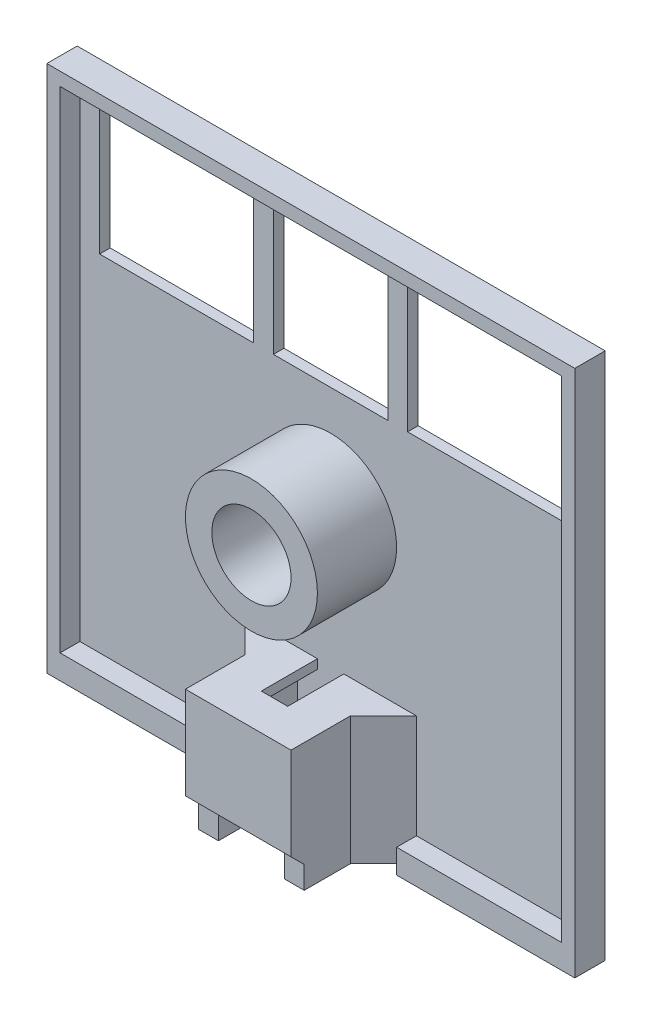
from build123d import *

# Parameters (mm, degrees)
SKETCH1_W           = 80
SKETCH1_H           = 80
BOSS_EXTRUDE1_DEPTH = 1.6
SKETCH2_R           = 10
SKETCH2_R_2         = 6
BOSS_EXTRUDE2_DEPTH = 12
SKETCH3_W           = 23.33
SKETCH3_H           = 20
SKETCH3_W_2         = 23.34
SKETCH3_W_3         = 17.33
CUT_EXTRUDE1_DEPTH  = 12
BOSS_EXTRUDE3_DEPTH = 12
SKETCH5_W           = 6
SKETCH5_H           = 1.4
BOSS_EXTRUDE4_DEPTH = 12
SKETCH6_W           = 16
SKETCH6_H           = 14
BOSS_EXTRUDE5_DEPTH = 2
CHAMFER1_SIZE       = 2
SKETCH7_W           = 4
SKETCH7_H           = 1.4
BOSS_EXTRUDE6_DEPTH = 3.5
CHAMFER2_SIZE       = 5
BOSS_EXTRUDE7_DEPTH = 3


with BuildPart() as part:
    # Sketch1 → Boss-Extrude1 (new body)
    with BuildSketch(Plane.XY):
        Rectangle(SKETCH1_W, SKETCH1_H)
    extrude(amount=BOSS_EXTRUDE1_DEPTH)

    # Sketch2 → Boss-Extrude2 (add)
    with BuildSketch(Plane.XY.offset(1.6)):
        Circle(SKETCH2_R)
        Circle(SKETCH2_R_2, mode=Mode.SUBTRACT)
    extrude(amount=BOSS_EXTRUDE2_DEPTH)

    # Sketch3 → Cut-Extrude1 (cut)
    with BuildSketch(Plane.XY.offset(1.6)):
        with Locations((-23.335, 26)):
            Rectangle(SKETCH3_W, SKETCH3_H)
        with Locations((23.33, 26)):
            Rectangle(SKETCH3_W_2, SKETCH3_H)
        with Locations((-0.005, 26)):
            Rectangle(SKETCH3_W_3, SKETCH3_H)
    extrude(amount=-CUT_EXTRUDE1_DEPTH, mode=Mode.SUBTRACT)

    # Sketch4 → Boss-Extrude3 (add)
    with BuildSketch(Plane.XY.offset(1.6)):
        Polygon((-5, -40), (-5, -25), (-5, -22), (-8, -22), (-8, -40), align=None)
        Polygon((5, -40), (5, -25), (5, -22), (8, -22), (8, -40), align=None)
    extrude(amount=BOSS_EXTRUDE3_DEPTH)

    # Sketch5 → Boss-Extrude4 (add)
    with BuildSketch(Plane.XY.offset(1.6)):
        with Locations((-5, -21.3)):
            Rectangle(SKETCH5_W, SKETCH5_H)
        with Locations((5, -21.3)):
            Rectangle(SKETCH5_W, SKETCH5_H)
    extrude(amount=BOSS_EXTRUDE4_DEPTH)

    # Sketch6 → Boss-Extrude5 (add)
    with BuildSketch(Plane.XY.offset(13.6)):
        with Locations((0, -27.6)):
            Rectangle(SKETCH6_W, SKETCH6_H)
    extrude(amount=BOSS_EXTRUDE5_DEPTH)

    # Chamfer1
    chamfer1_edges = [part.edges().sort_by_distance(p)[0] for p in [
        (6.5, -34.6, 13.6),
        (-6.5, -34.6, 13.6),
    ]]
    chamfer(chamfer1_edges, length=CHAMFER1_SIZE - 0.0001)  # a hair under: the kernel refuses the full size

    # Sketch7 → Boss-Extrude6 (add)
    with BuildSketch(Plane(origin=(0, 0, 13.6), x_dir=(-1, 0, 0), z_dir=(0, 0, -1))):
        with Locations((0, -21.3)):
            Rectangle(SKETCH7_W, SKETCH7_H)
    extrude(amount=BOSS_EXTRUDE6_DEPTH)

    # Chamfer2
    chamfer2_edges = [part.edges().sort_by_distance(p)[0] for p in [
        (8, -30.3, 1.6),
        (-8, -30.3, 1.6),
    ]]
    chamfer(chamfer2_edges, length=CHAMFER2_SIZE)

    # Sketch8 → Boss-Extrude7 (add)
    with BuildSketch(Plane.XY.offset(1.6)):
        Polygon((-13, -36.339774094), (-13, -40), (-40, -40), (-40, 40), (40, 40), (40, -40), (13, -40), (13, -36.339774094), (38, -36.339774094), (38, 38), (-38, 38), (-38, -36.339774094), align=None)
    extrude(amount=BOSS_EXTRUDE7_DEPTH)


solid = part.part
